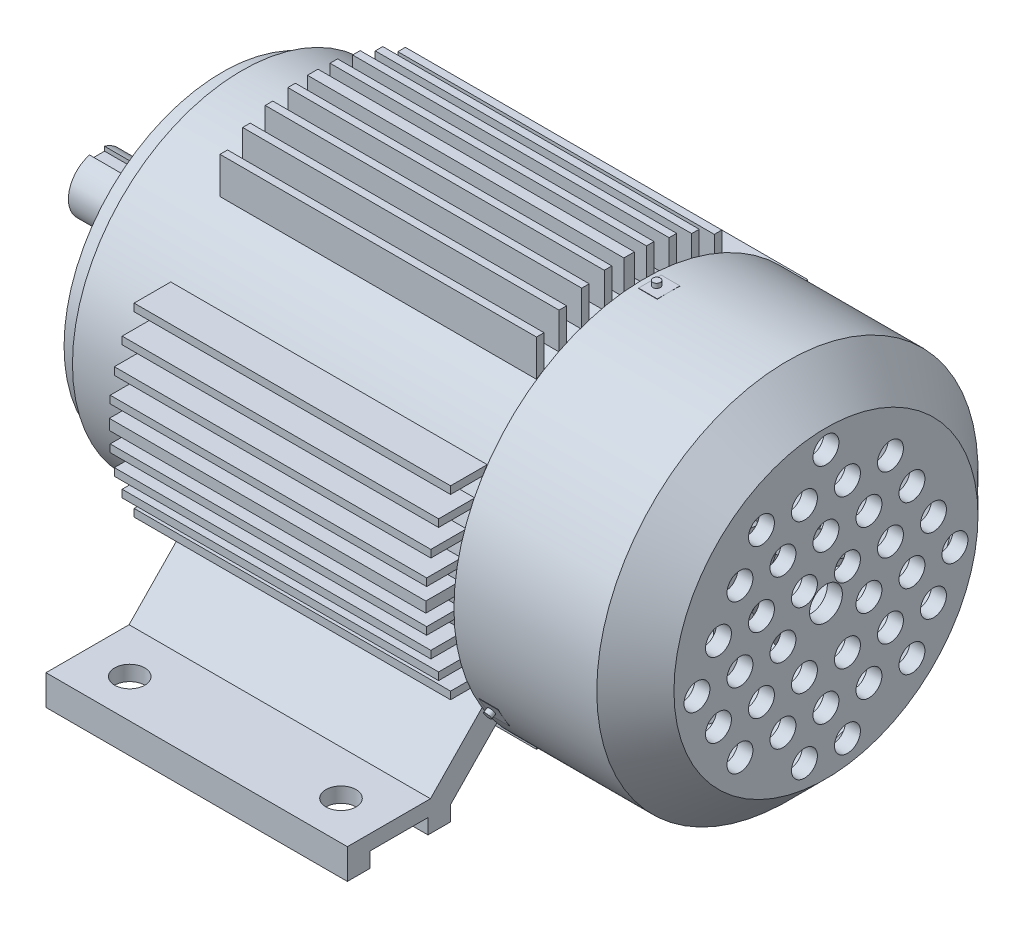
from build123d import *

# Parameters (mm, degrees)
ESQUISSE2_W                         = 10
ESQUISSE2_H                         = 7
ENL_V_MAT_EXTRU_3_DEPTH             = 76.120854157
BOSS_EXTRU_1_DEPTH                  = 12.5
ESQUISSE4_R                         = 2.5
BOSS_EXTRU_2_DEPTH                  = 3
R_P_TITION_CIRCULAIRE1_COUNT        = 3
ESQUISSE5_R                         = 75
BOSS_EXTRU_3_DEPTH                  = 4
ESQUISSE6_R                         = 22.5
ESQUISSE6_R_2                       = 17.75
BOSS_EXTRU_4_DEPTH                  = 30
ESQUISSE8_R                         = 17.75
BOSS_EXTRU_5_DEPTH                  = 35
BOSS_EXTRU_6_DEPTH                  = 4
R_P_TITION_CIRCULAIRE2_COUNT        = 12
BOSS_EXTRU_7_START                  = -200
BOSS_EXTRU_7_DEPTH                  = 200
ESQUISSE12_R                        = 10
ENL_V_MAT_EXTRU_4_DEPTH             = 131
ESQUISSE15_R                        = 8.591211058
ENL_V_MAT_EXTRU_5_DEPTH             = 14
R_P_TITION_START                    = 473.735395637
R_P_TITION_DANS_UNE_ZONE1_OUTLINE_R = 8.591211058
R_P_TITION_DANS_UNE_ZONE1_DEPTH     = 10
ESQUISSE18_W                        = 30
ESQUISSE18_H                        = 7
ESQUISSE18_H_2                      = 5
BOSS_EXTRU_8_DEPTH                  = 210
R_P_TITION_CIRCULAIRE3_COUNT        = 4


# Read off the part's stored shape, not the designer's step: Répétition dans une zone1
with BuildPart() as part:
    # Esquisse1 → Révolution1 (revolve)
    with BuildSketch(Plane.XY, mode=Mode.PRIVATE) as r_volution1_sk:
        Polygon((0, 0), (0, 19), (76.120854157, 19), (76.120854157, 32), (83.120854157, 32), (83.120854157, 105), (96.196122974, 105), (96.196122974, 112.5), (379.332897168, 112.5), (379.332897168, 32), (386.332897168, 32), (386.332897168, 19), (394.332897168, 19), (394.332897168, 0), align=None)
    revolve(r_volution1_sk.sketch.rotate(Axis((0, 0, 0), (1, 0, 0)), 90), axis=Axis((0, 0, 0), (1, 0, 0)))

    # Esquisse2 → Enlèv. mat.-Extru.3 (cut)
    with BuildSketch(Plane.ZY):
        with Locations((0, 19)):
            Rectangle(ESQUISSE2_W, ESQUISSE2_H)
    extrude(amount=-ENL_V_MAT_EXTRU_3_DEPTH, mode=Mode.SUBTRACT)

    # Esquisse3 → Boss.-Extru.1 (add)
    with BuildSketch(Plane(origin=(379.332897168, 0, 0), x_dir=(0, 0, -1), z_dir=(1, 0, 0))):
        with BuildLine():
            Line((7.5, 112.249721603), (7.5, 126.5))
            Line((7.5, 126.5), (-7.5, 126.5))
            Line((-7.5, 126.5), (-7.5, 112.249721603))
            ThreePointArc((-7.5, 112.249721603), (0, 112.5), (7.5, 112.249721603))
        make_face()
    boss_extru_1 = extrude(amount=-BOSS_EXTRU_1_DEPTH)

    # Esquisse4 → Boss.-Extru.2 (add)
    with BuildSketch(Plane(origin=(0, 126.5, 0), x_dir=(1, 0, 0), z_dir=(0, 1, 0))):
        with Locations(Location((371.332897168, 0, 0), (0, 0, 270))):
            Circle(ESQUISSE4_R)
    boss_extru_2 = extrude(amount=BOSS_EXTRU_2_DEPTH)

    # Répétition circulaire1: Boss.-Extru.1, Boss.-Extru.2 ×3 about axis
    r_p_tition_circulaire1_axis = Axis((0, 0, 0), (1, 0, 0))
    add([boss_extru_1.rotate(r_p_tition_circulaire1_axis, i * 360 / R_P_TITION_CIRCULAIRE1_COUNT) for i in range(1, R_P_TITION_CIRCULAIRE1_COUNT)])
    add([boss_extru_2.rotate(r_p_tition_circulaire1_axis, i * 360 / R_P_TITION_CIRCULAIRE1_COUNT) for i in range(1, R_P_TITION_CIRCULAIRE1_COUNT)])

    # Esquisse5 → Boss.-Extru.3 (add)
    with BuildSketch(Plane(origin=(394.332897168, 0, 0), x_dir=(0, 0, -1), z_dir=(1, 0, 0))):
        Circle(ESQUISSE5_R)
    extrude(amount=BOSS_EXTRU_3_DEPTH)

    # Esquisse6 → Boss.-Extru.4 (add)
    with BuildSketch(Plane(origin=(398.332897168, 0, 0), x_dir=(0, 0, -1), z_dir=(1, 0, 0))):
        Circle(ESQUISSE6_R)
        Circle(ESQUISSE6_R_2, mode=Mode.SUBTRACT)
    extrude(amount=BOSS_EXTRU_4_DEPTH)

    # Esquisse8 → Boss.-Extru.5 (add)
    with BuildSketch(Plane(origin=(398.332897168, 0, 0), x_dir=(0, 0, -1), z_dir=(1, 0, 0))):
        Circle(ESQUISSE8_R)
    extrude(amount=BOSS_EXTRU_5_DEPTH)

    # Esquisse10 → Boss.-Extru.6 (add)
    with BuildSketch(Plane.XY):
        with BuildLine():
            Line((394.332897168, 20.904309275), (394.332897168, 115.477889322))
            ThreePointArc((394.332897168, 115.477889322), (422.117505015, 91.287240764), (433.827281667, 56.35798309))
            ThreePointArc((433.827281667, 56.35798309), (426.286376545, 35.240660564), (409.044694711, 20.904309275))
            Line((409.044694711, 20.904309275), (394.332897168, 20.904309275))
        make_face()
    boss_extru_6 = extrude(amount=BOSS_EXTRU_6_DEPTH)

    # Répétition circulaire2: Boss.-Extru.6 ×12 about axis
    r_p_tition_circulaire2_axis = Axis((0, 0, 0), (1, 0, 0))
    for i in range(1, R_P_TITION_CIRCULAIRE2_COUNT):
        add(boss_extru_6.rotate(r_p_tition_circulaire2_axis, i * 360 / R_P_TITION_CIRCULAIRE2_COUNT))

    # Esquisse11 → Boss.-Extru.7 (add)
    with BuildSketch(Plane.ZY.offset(-143.120854157).offset(BOSS_EXTRU_7_START)):
        with BuildLine():
            Line((-75, -73.484692283), (-121.864145949, -121.663250429))
            Line((-121.864145949, -121.663250429), (-176.985321129, -121.663250429))
            Line((-176.985321129, -121.663250429), (-176.985321129, -141.663250429))
            Line((-176.985321129, -141.663250429), (-161.985321129, -141.663250429))
            Line((-161.985321129, -141.663250429), (-161.985321129, -131.663250429))
            Line((-161.985321129, -131.663250429), (-123.500379389, -131.663250429))
            Line((-123.500379389, -131.663250429), (-123.500379389, -141.663250429))
            Line((-123.500379389, -141.663250429), (-108.500379389, -141.663250429))
            Line((-108.500379389, -141.663250429), (-108.500379389, -131.663250429))
            Line((-108.500379389, -131.663250429), (-62.5, -84.372685153))
            ThreePointArc((-62.5, -84.372685153), (-68.9652057, -79.175756408), (-75, -73.484692283))
        make_face()
        with BuildLine():
            Line((108.500379389, -141.663250429), (108.500379389, -131.663250429))
            Line((108.500379389, -131.663250429), (62.5, -84.372685153))
            ThreePointArc((62.5, -84.372685153), (68.9652057, -79.175756408), (75, -73.484692283))
            Line((75, -73.484692283), (121.864145949, -121.663250429))
            Line((121.864145949, -121.663250429), (176.985321129, -121.663250429))
            Line((176.985321129, -121.663250429), (176.985321129, -141.663250429))
            Line((176.985321129, -141.663250429), (161.985321129, -141.663250429))
            Line((161.985321129, -141.663250429), (161.985321129, -131.663250429))
            Line((161.985321129, -131.663250429), (123.500379389, -131.663250429))
            Line((123.500379389, -131.663250429), (123.500379389, -141.663250429))
            Line((123.500379389, -141.663250429), (108.500379389, -141.663250429))
        make_face()
    extrude(amount=BOSS_EXTRU_7_DEPTH)

    # Esquisse12 → Enlèv. mat.-Extru.4 (cut)
    with BuildSketch(Plane(origin=(0, -121.663250429, 0), x_dir=(1, 0, 0), z_dir=(0, 1, 0))):
        with Locations(Location((173.120854157, -151.416711415, 0), (0, 0, 270))):
            Circle(ESQUISSE12_R)
        with Locations(Location((313.178244467, -151.279490922, 0), (0, 0, 270))):
            Circle(ESQUISSE12_R)
    enl_v_mat_extru_4 = extrude(amount=-ENL_V_MAT_EXTRU_4_DEPTH, mode=Mode.SUBTRACT)

    # Symétrie1: Enlèv. mat.-Extru.4 across plane
    add(enl_v_mat_extru_4.mirror(Plane.XY), mode=Mode.SUBTRACT)

    # Esquisse13 → Révol.-Mince1 (revolve)
    with BuildSketch(Plane.XY, mode=Mode.PRIVATE) as r_vol_mince1_sk:
        Polygon((363.343293301, 126.5), (458.125208959, 126.5), (483.735395637, 100.889813321), (483.735395637, 10.889813321), (473.735395637, 10.889813321), (473.735395637, 96.747677698), (453.983073335, 116.5), (363.343293301, 116.5), align=None)
    revolve(r_vol_mince1_sk.sketch.rotate(Axis((0, 0, 0), (1, 0, 0)), 90), axis=Axis((0, 0, 0), (1, 0, 0)))

    # Esquisse15 → Enlèv. mat.-Extru.5 (cut)
    with BuildSketch(Plane(origin=(483.735395637, 0, 0), x_dir=(0, 0, -1), z_dir=(1, 0, 0))):
        with Locations((0, 88.257538708)):
            Circle(ESQUISSE15_R)
    extrude(amount=-ENL_V_MAT_EXTRU_5_DEPTH, mode=Mode.SUBTRACT)

    # Répétition dans une zone1 outline → Répétition dans une zone1 (cut)
    with BuildSketch(Plane.YZ.offset(R_P_TITION_START)):
        with Locations((-10.593886445, 85.607845383)):
            Circle(R_P_TITION_DANS_UNE_ZONE1_OUTLINE_R)
        with Locations((-10.593886445, -85.607845383)):
            Circle(R_P_TITION_DANS_UNE_ZONE1_OUTLINE_R)
        with Locations((-60.019599021, 57.071896922)):
            Circle(R_P_TITION_DANS_UNE_ZONE1_OUTLINE_R)
        with Locations((-35.306742733, 42.803922691)):
            Circle(R_P_TITION_DANS_UNE_ZONE1_OUTLINE_R)
        with Locations((-10.593886445, 28.535948461)):
            Circle(R_P_TITION_DANS_UNE_ZONE1_OUTLINE_R)
        with Locations((14.118969843, 14.26797423)):
            Circle(R_P_TITION_DANS_UNE_ZONE1_OUTLINE_R)
        with Locations((38.831826132, 0)):
            Circle(R_P_TITION_DANS_UNE_ZONE1_OUTLINE_R)
        with Locations((63.54468242, -14.26797423)):
            Circle(R_P_TITION_DANS_UNE_ZONE1_OUTLINE_R)
        with Locations((-60.019599021, 28.535948461)):
            Circle(R_P_TITION_DANS_UNE_ZONE1_OUTLINE_R)
        with Locations((-35.306742733, 14.26797423)):
            Circle(R_P_TITION_DANS_UNE_ZONE1_OUTLINE_R)
        with Locations((-35.306742733, 71.339871152)):
            Circle(R_P_TITION_DANS_UNE_ZONE1_OUTLINE_R)
        with Locations((63.54468242, 42.803922691)):
            Circle(R_P_TITION_DANS_UNE_ZONE1_OUTLINE_R)
        with Locations((38.831826132, 57.071896922)):
            Circle(R_P_TITION_DANS_UNE_ZONE1_OUTLINE_R)
        with Locations((14.118969843, 71.339871152)):
            Circle(R_P_TITION_DANS_UNE_ZONE1_OUTLINE_R)
        with Locations((-10.593886445, 57.071896922)):
            Circle(R_P_TITION_DANS_UNE_ZONE1_OUTLINE_R)
        with Locations((14.118969843, 42.803922691)):
            Circle(R_P_TITION_DANS_UNE_ZONE1_OUTLINE_R)
        with Locations((38.831826132, 28.535948461)):
            Circle(R_P_TITION_DANS_UNE_ZONE1_OUTLINE_R)
        with Locations((63.54468242, 14.26797423)):
            Circle(R_P_TITION_DANS_UNE_ZONE1_OUTLINE_R)
        with Locations((-35.306742733, -42.803922691)):
            Circle(R_P_TITION_DANS_UNE_ZONE1_OUTLINE_R)
        with Locations((-60.019599021, -28.535948461)):
            Circle(R_P_TITION_DANS_UNE_ZONE1_OUTLINE_R)
        with Locations((-84.732455309, -14.26797423)):
            Circle(R_P_TITION_DANS_UNE_ZONE1_OUTLINE_R)
        with Locations((38.831826132, -57.071896922)):
            Circle(R_P_TITION_DANS_UNE_ZONE1_OUTLINE_R)
        with Locations((-10.593886445, -57.071896922)):
            Circle(R_P_TITION_DANS_UNE_ZONE1_OUTLINE_R)
        with Locations((14.118969843, -71.339871152)):
            Circle(R_P_TITION_DANS_UNE_ZONE1_OUTLINE_R)
        with Locations((-60.019599021, -57.071896922)):
            Circle(R_P_TITION_DANS_UNE_ZONE1_OUTLINE_R)
        with Locations((-35.306742733, -71.339871152)):
            Circle(R_P_TITION_DANS_UNE_ZONE1_OUTLINE_R)
        with Locations((-84.732455309, 14.26797423)):
            Circle(R_P_TITION_DANS_UNE_ZONE1_OUTLINE_R)
        with Locations((63.54468242, -42.803922691)):
            Circle(R_P_TITION_DANS_UNE_ZONE1_OUTLINE_R)
        with Locations((38.831826132, -28.535948461)):
            Circle(R_P_TITION_DANS_UNE_ZONE1_OUTLINE_R)
        with Locations((14.118969843, -14.26797423)):
            Circle(R_P_TITION_DANS_UNE_ZONE1_OUTLINE_R)
        with Locations((-60.019599021, 0)):
            Circle(R_P_TITION_DANS_UNE_ZONE1_OUTLINE_R)
        with Locations((-35.306742733, -14.26797423)):
            Circle(R_P_TITION_DANS_UNE_ZONE1_OUTLINE_R)
        with Locations((-10.593886445, -28.535948461)):
            Circle(R_P_TITION_DANS_UNE_ZONE1_OUTLINE_R)
        with Locations((14.118969843, -42.803922691)):
            Circle(R_P_TITION_DANS_UNE_ZONE1_OUTLINE_R)
    extrude(amount=R_P_TITION_DANS_UNE_ZONE1_DEPTH, mode=Mode.SUBTRACT)

    # Esquisse18 → Boss.-Extru.8 (add)
    with BuildSketch(Plane.ZY.offset(-143.120854157)):
        with Locations((119.941650454, 0)):
            Rectangle(ESQUISSE18_W, ESQUISSE18_H)
        with Locations((119.368338111, 14)):
            Rectangle(ESQUISSE18_W, ESQUISSE18_H_2)
        with Locations((116.600935035, 29)):
            Rectangle(ESQUISSE18_W, ESQUISSE18_H_2)
        with Locations((111.450764642, 44)):
            Rectangle(ESQUISSE18_W, ESQUISSE18_H_2)
        with Locations((103.502824814, 59)):
            Rectangle(ESQUISSE18_W, ESQUISSE18_H_2)
        with Locations((103.502824814, -59)):
            Rectangle(ESQUISSE18_W, ESQUISSE18_H_2)
        with Locations((111.450764642, -44)):
            Rectangle(ESQUISSE18_W, ESQUISSE18_H_2)
        with Locations((116.600935035, -29)):
            Rectangle(ESQUISSE18_W, ESQUISSE18_H_2)
        with Locations((119.368338111, -14)):
            Rectangle(ESQUISSE18_W, ESQUISSE18_H_2)
    boss_extru_8 = extrude(amount=-BOSS_EXTRU_8_DEPTH)

    # Répétition circulaire3: Boss.-Extru.8 ×4 about axis
    r_p_tition_circulaire3_axis = Axis((0, 0, 0), (1, 0, 0))
    for i in range(1, R_P_TITION_CIRCULAIRE3_COUNT):
        add(boss_extru_8.rotate(r_p_tition_circulaire3_axis, i * 360 / R_P_TITION_CIRCULAIRE3_COUNT))


solid = part.part
